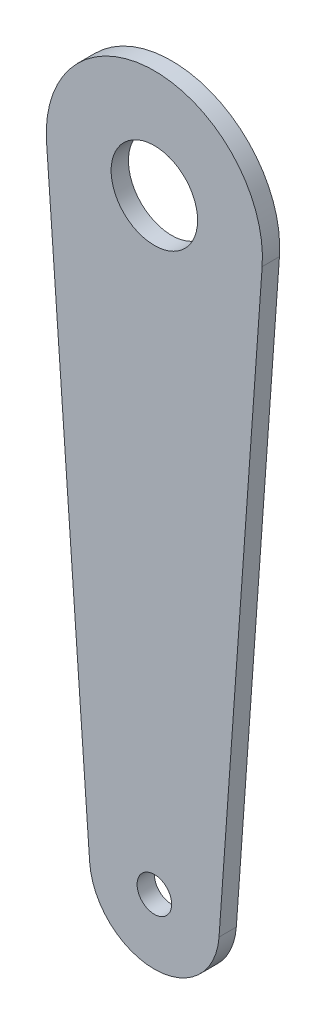
from build123d import *

# Parameters (mm, degrees)
CROQUIS1_R              = 4
CROQUIS1_R_2            = 10
SALIENTE_EXTRUIR1_DEPTH = 4


with BuildPart() as part:
    # Croquis1 → Saliente-Extruir1 (new body)
    with BuildSketch(Plane.XY):
        with BuildLine():
            Line((-24.936142935, 126.639285714), (-14.961685761, -12.646428571))
            ThreePointArc((-14.961685761, -12.646428571), (0, -26.575), (14.961685761, -12.646428571))
            Line((14.961685761, -12.646428571), (24.936142935, 126.639285714))
            ThreePointArc((24.936142935, 126.639285714), (0, 153.425), (-24.936142935, 126.639285714))
        make_face()
        with Locations((0, -11.575)):
            Circle(CROQUIS1_R, mode=Mode.SUBTRACT)
        with Locations((0, 128.425)):
            Circle(CROQUIS1_R_2, mode=Mode.SUBTRACT)
    extrude(amount=SALIENTE_EXTRUIR1_DEPTH)


solid = part.part
